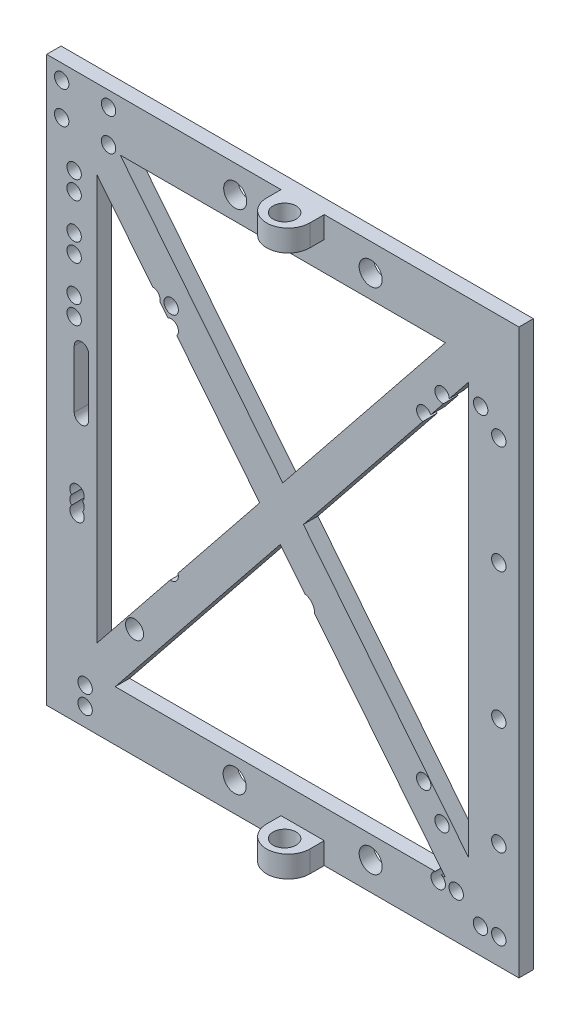
from build123d import *

# Parameters (mm, degrees)
SKETCH3_W            = 65.532
SKETCH3_H            = 78.232
SKETCH3_R            = 1
SKETCH3_R_2          = 1.25
SKETCH3_R_3          = 1.6
BOSS_EXTRUDE10_DEPTH = 2
SKETCH5_R            = 1.6
BOSS_EXTRUDE11_DEPTH = 3


with BuildPart() as part:
    # Sketch3 → Boss-Extrude10 (new body)
    with BuildSketch(Plane.XY):
        with Locations((-32.766, 39.116)):
            Rectangle(SKETCH3_W, SKETCH3_H)
        with Locations((-60.198, 2.535)):
            Circle(SKETCH3_R, mode=Mode.SUBTRACT)
        with Locations((-60.198, 5.075)):
            Circle(SKETCH3_R, mode=Mode.SUBTRACT)
        with Locations((-53.34, 15.24)):
            Circle(SKETCH3_R_2, mode=Mode.SUBTRACT)
        with Locations((-39.450944, 4.064)):
            Circle(SKETCH3_R_3, mode=Mode.SUBTRACT)
        with BuildLine():
            ThreePointArc((-60.547487864, 25.781), (-60.378588258, 25.483259443), (-60.32, 25.146))
            ThreePointArc((-60.32, 25.146), (-61.657259443, 24.204588258), (-62.092512136, 25.781))
            ThreePointArc((-62.092512136, 25.781), (-62.32, 26.416), (-62.092512136, 27.051))
            ThreePointArc((-62.092512136, 27.051), (-61.657259443, 28.627411742), (-60.32, 27.686))
            ThreePointArc((-60.32, 27.686), (-60.378588258, 27.348740557), (-60.547487864, 27.051))
            ThreePointArc((-60.547487864, 27.051), (-60.378588258, 26.753259443), (-60.32, 26.416))
            ThreePointArc((-60.32, 26.416), (-60.378588258, 26.078740557), (-60.547487864, 25.781))
        make_face(mode=Mode.SUBTRACT)
        with BuildLine():
            Line((-11.628420455, 7), (-56.019094707, 7))
            Line((-56.019094707, 7), (-33.112109743, 35.552384115))
            Line((-33.112109743, 35.552384115), (-29.697720228, 31.296522373))
            ThreePointArc((-29.697720228, 31.296522373), (-28.738744364, 30.752879791), (-28.359, 29.718))
            ThreePointArc((-28.359, 29.718), (-28.359594089, 29.67440261), (-28.361375915, 29.630837597))
            Line((-28.361375915, 29.630837597), (-10.205124779, 7))
            Line((-10.205124779, 7), (-10.773355545, 7))
            ThreePointArc((-10.773355545, 7), (-10.356041134, 6.631008199), (-10.200888, 6.096))
            ThreePointArc((-10.200888, 6.096), (-11.735896199, 5.251153134), (-11.628420455, 7))
        make_face(mode=Mode.SUBTRACT)
        with Locations((-20.574, 3.890944)):
            Circle(SKETCH3_R_3, mode=Mode.SUBTRACT)
        with Locations((-8.700888, 6.096)):
            Circle(SKETCH3_R, mode=Mode.SUBTRACT)
        with Locations((-5.339, 3.556)):
            Circle(SKETCH3_R, mode=Mode.SUBTRACT)
        with Locations((-2.799, 3.556)):
            Circle(SKETCH3_R, mode=Mode.SUBTRACT)
        with Locations((-10.668, 13.208)):
            Circle(SKETCH3_R, mode=Mode.SUBTRACT)
        with Locations((-13.213, 17.018)):
            Circle(SKETCH3_R, mode=Mode.SUBTRACT)
        with Locations((-2.794, 14.728)):
            Circle(SKETCH3_R, mode=Mode.SUBTRACT)
        with Locations((-2.794, 29.718)):
            Circle(SKETCH3_R, mode=Mode.SUBTRACT)
        with BuildLine():
            ThreePointArc((-61.706, 45.116), (-60.706, 46.116), (-59.706, 45.116))
            Line((-59.706, 45.116), (-59.706, 37.116))
            ThreePointArc((-59.706, 37.116), (-60.706, 36.116), (-61.706, 37.116))
            Line((-61.706, 37.116), (-61.706, 45.116))
        make_face(mode=Mode.SUBTRACT)
        with Locations((-61.722, 48.629)):
            Circle(SKETCH3_R, mode=Mode.SUBTRACT)
        with Locations((-61.722, 51.169)):
            Circle(SKETCH3_R, mode=Mode.SUBTRACT)
        with Locations((-61.722, 56.129)):
            Circle(SKETCH3_R, mode=Mode.SUBTRACT)
        with Locations((-61.722, 58.669)):
            Circle(SKETCH3_R, mode=Mode.SUBTRACT)
        with BuildLine():
            Line((-58.532, 10.995023961), (-58.532, 67.236976039))
            Line((-58.532, 67.236976039), (-50.821827001, 57.626640091))
            ThreePointArc((-50.821827001, 57.626640091), (-50.014999166, 57.252778474), (-49.824952048, 56.384086494))
            Line((-49.824952048, 56.384086494), (-48.700366603, 54.982348306))
            ThreePointArc((-48.700366603, 54.982348306), (-47.474999166, 54.712778474), (-47.477503777, 53.458112393))
            Line((-47.477503777, 53.458112393), (-35.971124779, 39.116))
            Line((-35.971124779, 39.116), (-47.320258494, 24.969885803))
            ThreePointArc((-47.320258494, 24.969885803), (-47.275179837, 24.801577784), (-47.26, 24.628))
            ThreePointArc((-47.26, 24.628), (-47.600460693, 23.876329925), (-48.390015804, 23.636488078))
            Line((-48.390015804, 23.636488078), (-58.532, 10.995023961))
        make_face(mode=Mode.SUBTRACT)
        with Locations((-48.255, 56.627)):
            Circle(SKETCH3_R, mode=Mode.SUBTRACT)
        Polygon((-32.766, 43.111023961), (-55.326875221, 71.232), (-10.205124779, 71.232), align=None, mode=Mode.SUBTRACT)
        with Locations((-61.722, 63.629)):
            Circle(SKETCH3_R, mode=Mode.SUBTRACT)
        with Locations((-61.722, 66.169)):
            Circle(SKETCH3_R, mode=Mode.SUBTRACT)
        with Locations((-63.448, 71.664)):
            Circle(SKETCH3_R, mode=Mode.SUBTRACT)
        with Locations((-63.448, 76.164)):
            Circle(SKETCH3_R, mode=Mode.SUBTRACT)
        with Locations((-56.948, 71.664)):
            Circle(SKETCH3_R, mode=Mode.SUBTRACT)
        with Locations((-56.948, 76.164)):
            Circle(SKETCH3_R, mode=Mode.SUBTRACT)
        with Locations((-39.37, 74.422)):
            Circle(SKETCH3_R_3, mode=Mode.SUBTRACT)
        with BuildLine():
            Line((-9.668009055, 64.774255485), (-7, 68.099792192))
            Line((-7, 68.099792192), (-7, 10.995023961))
            Line((-7, 10.995023961), (-29.906984964, 39.547408077))
            Line((-29.906984964, 39.547408077), (-13.321002101, 60.220986655))
            ThreePointArc((-13.321002101, 60.220986655), (-13.983000834, 61.839778474), (-12.259188179, 61.544483353))
            Line((-12.259188179, 61.544483353), (-10.455353631, 63.792870775))
            ThreePointArc((-10.455353631, 63.792870775), (-11.448000834, 65.395778474), (-9.668009055, 64.774255485))
        make_face(mode=Mode.SUBTRACT)
        with Locations((-2.794, 48.514)):
            Circle(SKETCH3_R, mode=Mode.SUBTRACT)
        with Locations((-20.574, 74.422)):
            Circle(SKETCH3_R_3, mode=Mode.SUBTRACT)
        with Locations((-2.794, 63.504)):
            Circle(SKETCH3_R, mode=Mode.SUBTRACT)
        with Locations((-5.309112, 66.04)):
            Circle(SKETCH3_R, mode=Mode.SUBTRACT)
    extrude(amount=BOSS_EXTRUDE10_DEPTH)

    # Sketch5 → Boss-Extrude11 (add)
    with BuildSketch(Plane.XZ):
        with BuildLine():
            Line((-33.014, 2), (-27.014, 2))
            Line((-27.014, 2), (-27.014, 4))
            ThreePointArc((-27.014, 4), (-30.014, 7), (-33.014, 4))
            Line((-33.014, 4), (-33.014, 2))
        make_face()
        with Locations((-30.014, 4.5)):
            Circle(SKETCH5_R, mode=Mode.SUBTRACT)
    boss_extrude11 = extrude(amount=-BOSS_EXTRUDE11_DEPTH)

    # Mirror1: Boss-Extrude11 across plane
    add(boss_extrude11.mirror(Plane.ZX.offset(39.116)))


solid = part.part
